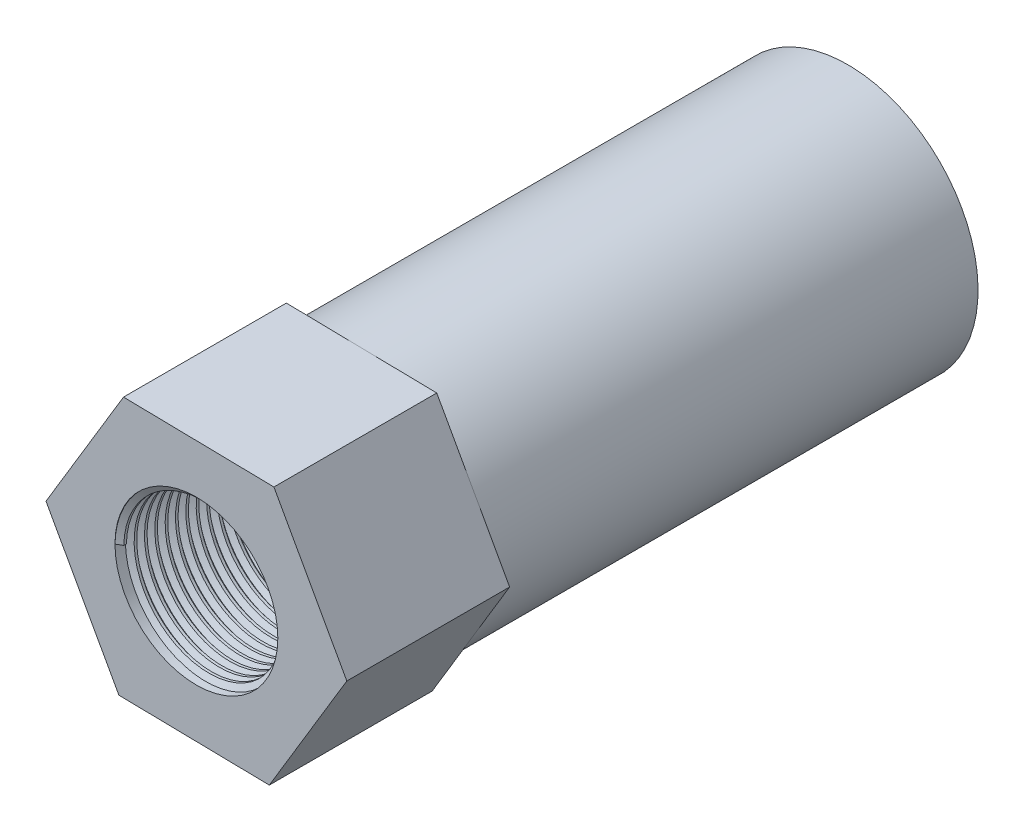
from build123d import *
from build123d.topology import SkipClean

# Parameters (mm, degrees)
BOSS_EXTRUDE1_DEPTH = 5
SKETCH2_R           = 4
BOSS_EXTRUDE2_DEPTH = 15
SKETCH3_R           = 2.5
CUT_EXTRUDE1_DEPTH  = 5
THREAD1_PITCH       = 0.3175
CUT_EXTRUDE2_START  = -5
SKETCH8_R           = 2.5
CUT_EXTRUDE2_DEPTH  = 5
THREAD2_PITCH       = 0.3175


with BuildPart() as part:
    # Sketch1 → Boss-Extrude1 (new body)
    with BuildSketch(Plane.XY):
        Polygon((-2.380053528, -3.958368166), (2.238020625, -4.040370901), (4.618074153, -0.082002735), (2.380053528, 3.958368166), (-2.238020625, 4.040370901), (-4.618074153, 0.082002735), align=None)
    extrude(amount=BOSS_EXTRUDE1_DEPTH)

    # Sketch2 → Boss-Extrude2 (add)
    with BuildSketch(Plane(origin=(0, 0, 0), x_dir=(-1, 0, 0), z_dir=(0, 0, -1))):
        with Locations(Location((0, 0, 0), (0, 0, 151.017289185))):
            Circle(SKETCH2_R)
    extrude(amount=BOSS_EXTRUDE2_DEPTH)

    # Sketch3 → Cut-Extrude1 (cut)
    with BuildSketch(Plane.XY.offset(5)):
        Circle(SKETCH3_R)
    extrude(amount=-CUT_EXTRUDE1_DEPTH, mode=Mode.SUBTRACT)

    # Thread1: the profile of Thread Profile2 profile screwed along a right-hand helix of 15.748031 turns, 6 arcs to a turn; built about Z, then put on its axis
    with SkipClean():  # the faces are left unmerged after this step: merging them gives an invalid solid
        thread1_z = Axis((0, 0, 0), (0, 0, 1))
        thread1_corners = [(2.5003, 0, -0.000173205), (2.5003, 0, 0.277985704), (2.328148085, 0, 0.17859375), (2.328148085, 0, 0.09921875)]
        with BuildLine(mode=Mode.PRIVATE) as thread1_profile:
            Line(thread1_corners[0], thread1_corners[1])
            Line(thread1_corners[1], thread1_corners[2])
            Line(thread1_corners[2], thread1_corners[3])
            Line(thread1_corners[3], thread1_corners[0])
        thread1_cap = Face(thread1_profile.wire())
        thread1_turn_angles = [0, 30, 60, 90, 120, 150, 180, 210, 240, 270, 300, 330, 360]
        thread1_turn_weights = [1, 0.8660254037844387, 1, 0.8660254037844387, 1, 0.8660254037844387, 1, 0.8660254037844387, 1, 0.8660254037844387, 1, 0.8660254037844387, 1]
        thread1_turn_rails = [Edge.make_bspline([Vector(p[0], p[1], 0).rotate(thread1_z, thread1_turn_angles[k]) / thread1_turn_weights[k] + Vector(0, 0, p[2] + THREAD1_PITCH * thread1_turn_angles[k] / 360) for k in range(13)], [0, 0, 0, 1, 1, 2, 2, 3, 3, 4, 4, 5, 5, 6, 6, 6], 2, thread1_turn_weights) for p in thread1_corners]
        thread1_turn_sides = [Face.make_surface_from_curves(thread1_turn_rails[p[0]], thread1_turn_rails[p[1]]) for p in [(0, 1), (1, 2), (2, 3), (3, 0)]]
        thread1_last_angles = [5400, 5430, 5460, 5490, 5520, 5550, 5580, 5610, 5640, 5654.645669291, 5669.291338583]
        thread1_last_weights = [1, 0.8660254037844387, 1, 0.8660254037844387, 1, 0.8660254037844387, 1, 0.8660254037844387, 1, 0.9675079437748915, 1]
        thread1_last_rails = [Edge.make_bspline([Vector(p[0], p[1], 0).rotate(thread1_z, thread1_last_angles[k]) / thread1_last_weights[k] + Vector(0, 0, p[2] + THREAD1_PITCH * thread1_last_angles[k] / 360) for k in range(11)], [0, 0, 0, 1, 1, 2, 2, 3, 3, 4, 4, 5, 5, 5], 2, thread1_last_weights) for p in thread1_corners]
        thread1_last_sides = [Face.make_surface_from_curves(thread1_last_rails[p[0]], thread1_last_rails[p[1]]) for p in [(0, 1), (1, 2), (2, 3), (3, 0)]]
        thread1 = Plane(origin=(0, 0, 5), x_dir=(-1, 0, 0), z_dir=(0, 0, -1)) * Solid(Shell([*[p.moved(Location((0, 0, THREAD1_PITCH * i))) for i in range(15) for p in thread1_turn_sides], *thread1_last_sides, thread1_cap, thread1_cap.rotate(thread1_z, 5669.291338583).moved(Location((0, 0, THREAD1_PITCH * 5669.291338583 / 360)))]))
        add(thread1)

    # Sketch8 → Cut-Extrude2 (cut)
    with SkipClean():  # the faces are left unmerged after this step: merging them gives an invalid solid
        with BuildSketch(Plane(origin=(0, 0, -15), x_dir=(-1, 0, 0), z_dir=(0, 0, -1)).offset(CUT_EXTRUDE2_START)):
            Circle(SKETCH8_R)
        extrude(amount=CUT_EXTRUDE2_DEPTH, mode=Mode.SUBTRACT)

    # Thread2: the profile of Thread Profile3 profile screwed along a right-hand helix of 15.748031 turns, 6 arcs to a turn; built about Z, then put on its axis
    with SkipClean():  # the faces are left unmerged after this step: merging them gives an invalid solid
        thread2_z = Axis((0, 0, 0), (0, 0, 1))
        thread2_corners = [(2.5003, 0, -0.000173205), (2.5003, 0, 0.277985704), (2.328148085, 0, 0.17859375), (2.328148085, 0, 0.09921875)]
        with BuildLine(mode=Mode.PRIVATE) as thread2_profile:
            Line(thread2_corners[0], thread2_corners[1])
            Line(thread2_corners[1], thread2_corners[2])
            Line(thread2_corners[2], thread2_corners[3])
            Line(thread2_corners[3], thread2_corners[0])
        thread2_cap = Face(thread2_profile.wire())
        thread2_turn_angles = [0, 30, 60, 90, 120, 150, 180, 210, 240, 270, 300, 330, 360]
        thread2_turn_weights = [1, 0.8660254037844387, 1, 0.8660254037844387, 1, 0.8660254037844387, 1, 0.8660254037844387, 1, 0.8660254037844387, 1, 0.8660254037844387, 1]
        thread2_turn_rails = [Edge.make_bspline([Vector(p[0], p[1], 0).rotate(thread2_z, thread2_turn_angles[k]) / thread2_turn_weights[k] + Vector(0, 0, p[2] + THREAD2_PITCH * thread2_turn_angles[k] / 360) for k in range(13)], [0, 0, 0, 1, 1, 2, 2, 3, 3, 4, 4, 5, 5, 6, 6, 6], 2, thread2_turn_weights) for p in thread2_corners]
        thread2_turn_sides = [Face.make_surface_from_curves(thread2_turn_rails[p[0]], thread2_turn_rails[p[1]]) for p in [(0, 1), (1, 2), (2, 3), (3, 0)]]
        thread2_last_angles = [5400, 5430, 5460, 5490, 5520, 5550, 5580, 5610, 5640, 5654.645669291, 5669.291338583]
        thread2_last_weights = [1, 0.8660254037844387, 1, 0.8660254037844387, 1, 0.8660254037844387, 1, 0.8660254037844387, 1, 0.9675079437748915, 1]
        thread2_last_rails = [Edge.make_bspline([Vector(p[0], p[1], 0).rotate(thread2_z, thread2_last_angles[k]) / thread2_last_weights[k] + Vector(0, 0, p[2] + THREAD2_PITCH * thread2_last_angles[k] / 360) for k in range(11)], [0, 0, 0, 1, 1, 2, 2, 3, 3, 4, 4, 5, 5, 5], 2, thread2_last_weights) for p in thread2_corners]
        thread2_last_sides = [Face.make_surface_from_curves(thread2_last_rails[p[0]], thread2_last_rails[p[1]]) for p in [(0, 1), (1, 2), (2, 3), (3, 0)]]
        thread2 = Plane(origin=(0, 0, -15), x_dir=(1, 0, 0), z_dir=(0, 0, 1)) * Solid(Shell([*[p.moved(Location((0, 0, THREAD2_PITCH * i))) for i in range(15) for p in thread2_turn_sides], *thread2_last_sides, thread2_cap, thread2_cap.rotate(thread2_z, 5669.291338583).moved(Location((0, 0, THREAD2_PITCH * 5669.291338583 / 360)))]))
        add(thread2)


solid = part.part
